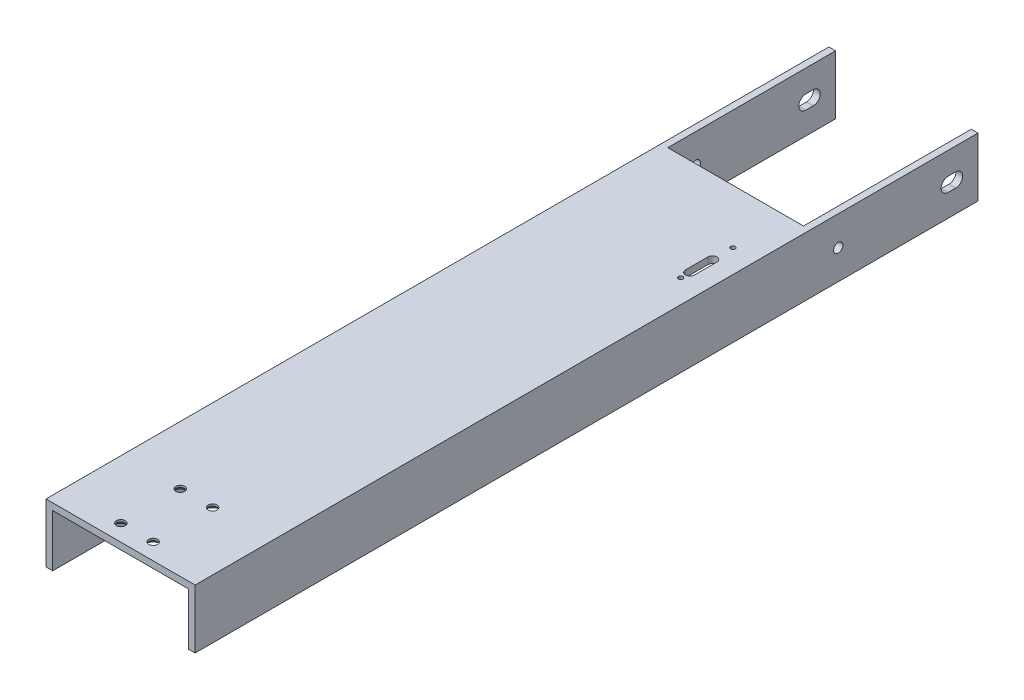
from build123d import *

# Parameters (mm, degrees)
BOSS_EXTRUDE1_DEPTH = 533.4
SKETCH3_R           = 1.524
SKETCH3_R_2         = 3
SKETCH3_W           = 92.456
SKETCH3_H           = 114.3
CUT_EXTRUDE1_DEPTH  = 538.314412075
SKETCH4_R           = 3.175
CUT_EXTRUDE2_DEPTH  = 545.47102533
CHAMFER1_SIZE       = 3.25


with BuildPart() as part:
    # Sketch1 → Boss-Extrude1 (new body)
    with BuildSketch(Plane.XY):
        Polygon((-50.8, 0), (50.8, 0), (50.8, -40.132), (46.228, -40.132), (46.228, -4.572), (-46.228, -4.572), (-46.228, -40.132), (-50.8, -40.132), align=None)
    extrude(amount=BOSS_EXTRUDE1_DEPTH)

    # Sketch3 → Cut-Extrude1 (cut, through all)
    with BuildSketch(Plane(origin=(0, 0, 0), x_dir=(1, 0, 0), z_dir=(0, 1, 0))):
        with Locations((34.925, -151.13)):
            Circle(SKETCH3_R)
        with Locations((34.925, -186.69)):
            Circle(SKETCH3_R)
        with Locations((-11.0109, -522.1859)):
            Circle(SKETCH3_R_2)
        with Locations((11.0109, -481.6729)):
            Circle(SKETCH3_R_2)
        with Locations((-11.0109, -481.6729)):
            Circle(SKETCH3_R_2)
        with Locations((11.0109, -522.1859)):
            Circle(SKETCH3_R_2)
        with Locations((0, -57.15)):
            Rectangle(SKETCH3_W, SKETCH3_H)
        with BuildLine():
            Line((37.973, -165.1), (37.973, -180.34))
            ThreePointArc((37.973, -180.34), (34.925, -183.388), (31.877, -180.34))
            Line((31.877, -180.34), (31.877, -165.1))
            ThreePointArc((31.877, -165.1), (34.925, -162.052), (37.973, -165.1))
        make_face()
    extrude(amount=-CUT_EXTRUDE1_DEPTH, mode=Mode.SUBTRACT)

    # Sketch4 → Cut-Extrude2 (cut, through all)
    with BuildSketch(Plane(origin=(50.8, 0, 0), x_dir=(0, 0, -1), z_dir=(1, 0, 0))):
        with Locations((-95.25, -20.066)):
            Circle(SKETCH4_R)
        with BuildLine():
            Line((-15.24, -24.8285), (-20.32, -24.8285))
            ThreePointArc((-20.32, -24.8285), (-25.0825, -20.066), (-20.32, -15.3035))
            Line((-20.32, -15.3035), (-15.24, -15.3035))
            ThreePointArc((-15.24, -15.3035), (-10.4775, -20.066), (-15.24, -24.8285))
        make_face()
    extrude(amount=-CUT_EXTRUDE2_DEPTH, mode=Mode.SUBTRACT)

    # Chamfer1
    chamfer1_edges = [part.edges().sort_by_distance(p)[0] for p in [
        (8.0109, -4.572, 481.6729),
        (8.0109, -4.572, 522.1859),
        (-14.0109, -4.572, 522.1859),
        (-14.0109, -4.572, 481.6729),
    ]]
    chamfer(chamfer1_edges, length=CHAMFER1_SIZE)


solid = part.part
